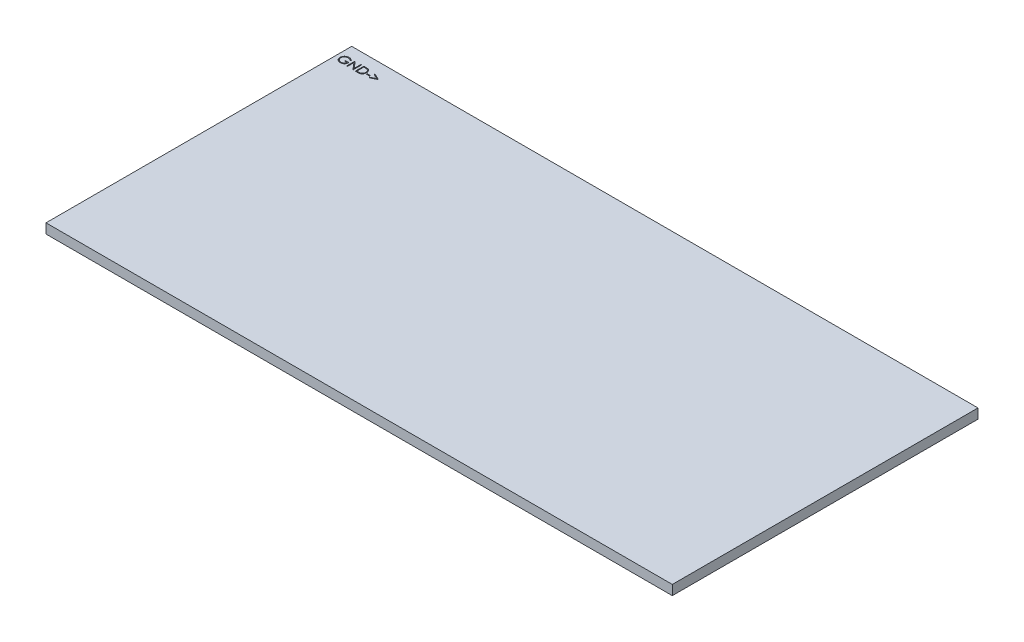
from build123d import *

# Parameters (mm, degrees)
SKETCH1_W           = 102
SKETCH1_H           = 49.784
BOSS_EXTRUDE1_DEPTH = 1.5875
SKETCH2_W           = 0.538461539
SKETCH2_H           = 0.143589744
CUT_EXTRUDE1_DEPTH  = 0.2
SKETCH5_W           = 0.538461539
SKETCH5_H           = 0.143589743
CUT_EXTRUDE2_DEPTH  = 0.2


with BuildPart() as part:
    # Sketch1 → Boss-Extrude1 (new body)
    with BuildSketch(Plane(origin=(0, 0, 0), x_dir=(1, 0, 0), z_dir=(0, 1, 0))):
        with Locations((51, 24.892)):
            Rectangle(SKETCH1_W, SKETCH1_H)
    extrude(amount=BOSS_EXTRUDE1_DEPTH)

    # Sketch2 → Cut-Extrude1 (cut)
    # profile 1 of 5: a face of its own
    with BuildSketch(Plane(origin=(0, 1.5875, 0), x_dir=(1, 0, 0), z_dir=(0, 1, 0))):
        with BuildLine():
            Line((1.979573781, 47.737471022), (1.871881473, 47.635387688))
            add(Edge.make_bspline(
                [(1.871881473, 47.635387688), (1.852393918, 47.653720034), (1.813883499, 47.689947579), (1.751099402, 47.736951977), (1.685593949, 47.777218417), (1.61770895, 47.809980911), (1.549125528, 47.836122016), (1.480754018, 47.854733272), (1.413295737, 47.866602287), (1.36842885, 47.868021634), (1.346320576, 47.868721022)],
                knots=[0, 0, 0, 0, 1.08915593, 2.152340314, 3.188132944, 4.216796309, 5.218260357, 6.173443236, 7.099959455, 8, 8, 8, 8], degree=3))
            add(Edge.make_bspline(
                [(1.346320576, 47.868721022), (1.332754696, 47.868555579), (1.30565812, 47.868225124), (1.265409342, 47.864007438), (1.225582687, 47.857941492), (1.186253337, 47.849164741), (1.147344823, 47.838041117), (1.108992466, 47.824126932), (1.071124724, 47.807904834), (1.034098292, 47.789159845), (0.99820209, 47.768567906), (0.964299356, 47.74574849), (0.932173996, 47.721432974), (0.902429826, 47.695012582), (0.874895752, 47.666726636), (0.848916403, 47.637101313), (0.825405484, 47.605327226), (0.804169018, 47.571988976), (0.785224371, 47.5376721), (0.76850091, 47.502706904), (0.754462074, 47.467209362), (0.743354292, 47.431134931), (0.734190031, 47.394762695), (0.727742988, 47.357840807), (0.724108299, 47.320329733), (0.723479587, 47.29521083), (0.723163525, 47.282583201)],
                knots=[0, 0, 0, 0, 1.02818874, 2.053710826, 3.065248034, 4.081641283, 5.106893873, 6.131558223, 7.173050175, 8.228653731, 9.27666206, 10.308777013, 11.325269123, 12.329503258, 13.32196095, 14.316845687, 15.314881793, 16.315733098, 17.311955233, 18.285320748, 19.252783886, 20.203351036, 21.145449891, 22.095197417, 23.042428769, 24, 24, 24, 24], degree=3))
            add(Edge.make_bspline(
                [(0.723163525, 47.282583201), (0.723465812, 47.269674874), (0.724069561, 47.243893469), (0.727933689, 47.20541584), (0.735104985, 47.167509679), (0.744692069, 47.130050426), (0.756684395, 47.092973926), (0.771633461, 47.056440922), (0.789339702, 47.020452766), (0.809834322, 46.985333719), (0.832308804, 46.95112451), (0.857486036, 46.918900701), (0.88423027, 46.88823319), (0.913515829, 46.859802885), (0.944403646, 46.832849326), (0.977816557, 46.808115117), (1.013097541, 46.785123828), (1.050300426, 46.76416522), (1.089021539, 46.745441806), (1.12872424, 46.728792248), (1.169535366, 46.715080513), (1.211240442, 46.703905271), (1.253789751, 46.694745152), (1.297399272, 46.68885216), (1.341748355, 46.684575828), (1.371643808, 46.68426316), (1.386705191, 46.684105637)],
                knots=[0, 0, 0, 0, 0.93586088, 1.869166235, 2.799637598, 3.729985548, 4.670839027, 5.622275134, 6.589130586, 7.576015415, 8.568469353, 9.55398029, 10.53834874, 11.515998671, 12.510579167, 13.508179873, 14.527009472, 15.561807829, 16.601455013, 17.643573243, 18.680854198, 19.719860599, 20.772568776, 21.833555941, 22.908541556, 24, 24, 24, 24], degree=3))
            add(Edge.make_bspline(
                [(1.386705191, 46.684105637), (1.40485653, 46.684485068), (1.440499633, 46.685230141), (1.49289421, 46.691030257), (1.543215438, 46.700088974), (1.59132192, 46.713355333), (1.637269528, 46.730276803), (1.681226705, 46.750674958), (1.722847368, 46.775332181), (1.762256637, 46.803161728), (1.798559512, 46.834167661), (1.831301161, 46.867625443), (1.859959357, 46.90337267), (1.884961237, 46.941198796), (1.905644698, 46.981416918), (1.922621816, 47.023829943), (1.935635133, 47.068456948), (1.940977123, 47.0992936), (1.943676345, 47.114874868)],
                knots=[0, 0, 0, 0, 1.13008108, 2.219097802, 3.278683437, 4.311054135, 5.322181354, 6.324827112, 7.324222904, 8.330512327, 9.32562643, 10.293043162, 11.24128371, 12.174520618, 13.111833804, 14.052305215, 15.015860969, 16, 16, 16, 16], degree=3))
            Line((1.943676345, 47.114874868), (1.477009678, 47.114874868))
            Line((1.477009678, 47.114874868), (1.477009678, 47.258464611))
            Line((1.477009678, 47.258464611), (2.069317371, 47.258464611))
            add(Edge.make_bspline(
                [(2.069317371, 47.258464611), (2.068635031, 47.231701616), (2.06729957, 47.179321599), (2.057932004, 47.102933491), (2.042805399, 47.030784814), (2.022141274, 46.962799585), (1.995391162, 46.899074148), (1.962842151, 46.839543801), (1.923973302, 46.784593129), (1.880169126, 46.733773527), (1.831009142, 46.688441843), (1.777821694, 46.648599467), (1.720518907, 46.615038421), (1.659154984, 46.587734156), (1.593930811, 46.566424558), (1.524695459, 46.551315928), (1.451542819, 46.542263942), (1.401408148, 46.541107391), (1.375767691, 46.540515893)],
                knots=[0, 0, 0, 0, 1.140356446, 2.231883559, 3.274166699, 4.278491846, 5.25512956, 6.21435461, 7.1637429, 8.11826594, 9.068280886, 10.0076534, 10.945064095, 11.891975133, 12.864533718, 13.863980011, 14.907571808, 16, 16, 16, 16], degree=3))
            add(Edge.make_bspline(
                [(1.375767691, 46.540515893), (1.359963637, 46.540743542), (1.328792949, 46.541192538), (1.282756578, 46.544383477), (1.237989529, 46.549295708), (1.194498326, 46.556713757), (1.152122989, 46.565799619), (1.111075155, 46.577434306), (1.071198458, 46.590901786), (1.032431264, 46.606220055), (0.995125445, 46.623968718), (0.959114838, 46.643692574), (0.924200388, 46.665289918), (0.890619922, 46.689134256), (0.858198473, 46.71504724), (0.827145096, 46.743080808), (0.797285945, 46.773149256), (0.778581759, 46.79450086), (0.769157114, 46.805259483)],
                knots=[0, 0, 0, 0, 1.107784379, 2.184907829, 3.233506516, 4.263428166, 5.276301166, 6.270063455, 7.25232949, 8.225834625, 9.190232166, 10.146266622, 11.1027726, 12.066435141, 13.031522626, 14.010570082, 14.99756817, 16, 16, 16, 16], degree=3))
            add(Edge.make_bspline(
                [(0.769157114, 46.805259483), (0.755482742, 46.822327744), (0.728360977, 46.856180951), (0.693449714, 46.910420929), (0.663689153, 46.966581673), (0.639542024, 47.024819524), (0.620686789, 47.08508001), (0.607164288, 47.147286126), (0.599241373, 47.211517978), (0.598099958, 47.254984084), (0.597522499, 47.276974227)],
                knots=[0, 0, 0, 0, 1.023165419, 2.029347347, 3.013907458, 3.994755782, 4.975994455, 5.96558838, 6.970761222, 8, 8, 8, 8], degree=3))
            add(Edge.make_bspline(
                [(0.597522499, 47.276974227), (0.597735394, 47.293440728), (0.598158479, 47.326164451), (0.603288685, 47.374747374), (0.610649253, 47.422467651), (0.621468074, 47.469286273), (0.63510658, 47.51523451), (0.652127975, 47.560333695), (0.671945933, 47.604610444), (0.694980132, 47.647759991), (0.720613915, 47.689209756), (0.748434004, 47.728792878), (0.778835444, 47.765788504), (0.811321763, 47.800665163), (0.84628056, 47.832984702), (0.883384329, 47.863046346), (0.922661666, 47.89089042), (0.964236138, 47.916078354), (1.007487212, 47.938703803), (1.052311212, 47.958539487), (1.098694457, 47.974932813), (1.146289448, 47.988842325), (1.195456448, 47.999128381), (1.245838663, 48.00658788), (1.297698708, 48.01169212), (1.332753119, 48.012102622), (1.350527307, 48.012310765)],
                knots=[0, 0, 0, 0, 1.008945113, 2.00506715, 2.99143336, 3.967273523, 4.948097931, 5.927297278, 6.919902385, 7.919676788, 8.923139349, 9.905703106, 10.883022732, 11.856032218, 12.825136022, 13.798837087, 14.781400844, 15.773989409, 16.776158564, 17.77167057, 18.775803737, 19.789618931, 20.80898985, 21.851988756, 22.910860228, 24, 24, 24, 24], degree=3))
            add(Edge.make_bspline(
                [(1.350527307, 48.012310765), (1.365022604, 48.012078969), (1.393765076, 48.011619343), (1.436535369, 48.008433484), (1.478644574, 48.003383931), (1.52015513, 47.996493217), (1.560925677, 47.98710774), (1.601072359, 47.975876427), (1.640653374, 47.962799698), (1.679544673, 47.947204159), (1.71800776, 47.929502709), (1.756256496, 47.90957734), (1.794160194, 47.887087338), (1.831784587, 47.861965924), (1.86936693, 47.834644557), (1.906312787, 47.804341827), (1.943513965, 47.772252725), (1.96743469, 47.749179852), (1.979573781, 47.737471022)],
                knots=[0, 0, 0, 0, 0.985871117, 1.954866573, 2.915460327, 3.869826059, 4.81536089, 5.759505086, 6.70452669, 7.649098992, 8.607881297, 9.583363685, 10.581137262, 11.603961102, 12.659522466, 13.73993555, 14.853081303, 16, 16, 16, 16], degree=3))
        make_face()
    # profile 2 of 5: a face of its own
    with BuildSketch(Plane(origin=(0, 1.5875, 0), x_dir=(1, 0, 0), z_dir=(0, 1, 0))):
        Polygon((2.356496858, 46.576413329), (2.356496858, 47.976413329), (2.382859037, 47.976413329), (3.307778909, 46.874530317), (3.307778909, 47.976413329), (3.433419935, 47.976413329), (3.433419935, 46.576413329), (3.404814166, 46.576413329), (2.482137884, 47.675772304), (2.482137884, 46.576413329), align=None)
    # profile 3 of 5: a face of its own
    with BuildSketch(Plane(origin=(0, 1.5875, 0), x_dir=(1, 0, 0), z_dir=(0, 1, 0))):
        with BuildLine():
            Line((3.792394294, 46.576413329), (3.792394294, 47.976413329))
            Line((3.792394294, 47.976413329), (4.075086602, 47.976413329))
            add(Edge.make_bspline(
                [(4.075086602, 47.976413329), (4.099674197, 47.976236301), (4.147177303, 47.975894284), (4.215822282, 47.973725728), (4.279335787, 47.969889541), (4.337508931, 47.964301731), (4.390501415, 47.957440517), (4.438164859, 47.948840356), (4.480745716, 47.938685088), (4.506933492, 47.930026907), (4.519317371, 47.92593256)],
                knots=[0, 0, 0, 0, 1.314313732, 2.53924729, 3.670748893, 4.714932338, 5.66265055, 6.526160246, 7.303039223, 8, 8, 8, 8], degree=3))
            add(Edge.make_bspline(
                [(4.519317371, 47.92593256), (4.535515266, 47.919760278), (4.567543743, 47.90755568), (4.613146592, 47.88453316), (4.656076738, 47.858447919), (4.696564396, 47.829265574), (4.733684726, 47.796159835), (4.768887885, 47.760537), (4.800733774, 47.721101664), (4.829897093, 47.678671669), (4.856191357, 47.633746848), (4.87904702, 47.586412805), (4.898028617, 47.536909921), (4.913785908, 47.485375862), (4.926204491, 47.431697311), (4.934677263, 47.375811765), (4.940265659, 47.317940089), (4.94082728, 47.278670303), (4.941112243, 47.25874506)],
                knots=[0, 0, 0, 0, 0.984719456, 1.947108742, 2.898477687, 3.838006223, 4.779231079, 5.722358779, 6.681677486, 7.655904652, 8.64651281, 9.637519902, 10.640069247, 11.656948941, 12.698408672, 13.768548281, 14.867775369, 16, 16, 16, 16], degree=3))
            add(Edge.make_bspline(
                [(4.941112243, 47.25874506), (4.940860656, 47.241440565), (4.940364877, 47.207340249), (4.935913151, 47.157083891), (4.929442623, 47.108318462), (4.919424944, 47.061276182), (4.907263938, 47.015544895), (4.891678278, 46.971611997), (4.873824079, 46.929074474), (4.853004128, 46.888507483), (4.830147574, 46.850074134), (4.805618877, 46.813843923), (4.779444198, 46.780333834), (4.751373945, 46.74944239), (4.721770859, 46.721216158), (4.690441126, 46.695419352), (4.657303906, 46.67255673), (4.622507617, 46.651729887), (4.585037165, 46.633561745), (4.544182819, 46.618189741), (4.499770348, 46.605451095), (4.451908765, 46.594822736), (4.400515374, 46.586391815), (4.345539787, 46.580741258), (4.287066472, 46.576920085), (4.246914765, 46.576585528), (4.226248461, 46.576413329)],
                knots=[0, 0, 0, 0, 1.105936401, 2.179363191, 3.223086493, 4.248585256, 5.251745608, 6.245858792, 7.225916811, 8.198733463, 9.158002045, 10.082870192, 10.993790845, 11.873723703, 12.748670949, 13.606408763, 14.465103618, 15.319838547, 16.196477973, 17.123216899, 18.106603292, 19.147568657, 20.255746949, 21.433717677, 22.679120308, 24, 24, 24, 24], degree=3))
            Line((4.226248461, 46.576413329), (3.792394294, 46.576413329))
        make_face()
        with BuildLine():
            Line((3.918035319, 46.720003073), (4.078732435, 46.720003073))
            add(Edge.make_bspline(
                [(4.078732435, 46.720003073), (4.101823783, 46.720102311), (4.146236903, 46.720293184), (4.210100101, 46.721968065), (4.26845186, 46.72470484), (4.321300464, 46.728534871), (4.368616074, 46.733602317), (4.410497573, 46.739252278), (4.446807677, 46.746291258), (4.468779452, 46.752671642), (4.478932755, 46.75562006)],
                knots=[0, 0, 0, 0, 1.375205317, 2.645023457, 3.804390687, 4.853969522, 5.800190428, 6.637939096, 7.370582563, 8, 8, 8, 8], degree=3))
            add(Edge.make_bspline(
                [(4.478932755, 46.75562006), (4.4917121, 46.760120683), (4.516965555, 46.769014433), (4.55331799, 46.785237497), (4.587220791, 46.804454325), (4.619264802, 46.825815235), (4.648995464, 46.850073635), (4.67676511, 46.876702031), (4.702517831, 46.905835941), (4.725987554, 46.937439206), (4.746990876, 46.971315124), (4.765179367, 47.007130657), (4.78111998, 47.044493381), (4.793631417, 47.083977045), (4.803437651, 47.125228668), (4.810383526, 47.168251154), (4.814709416, 47.213036466), (4.815213995, 47.243497316), (4.815471217, 47.259025509)],
                knots=[0, 0, 0, 0, 0.998632004, 1.973411704, 2.929992603, 3.868527914, 4.809262121, 5.754881198, 6.702106254, 7.672490631, 8.653608572, 9.636854334, 10.631411391, 11.644891563, 12.686317036, 13.754757253, 14.855430412, 16, 16, 16, 16], degree=3))
            add(Edge.make_bspline(
                [(4.815471217, 47.259025509), (4.815265902, 47.275398901), (4.814862559, 47.307564575), (4.809792835, 47.354760853), (4.802384213, 47.400153113), (4.791670738, 47.443744391), (4.778018387, 47.485619732), (4.76098053, 47.525547536), (4.741513882, 47.563949484), (4.718352547, 47.59993923), (4.69298631, 47.633976474), (4.664835158, 47.66515844), (4.634346343, 47.69355616), (4.601852403, 47.719611885), (4.566437563, 47.742277355), (4.528936087, 47.762552028), (4.488797819, 47.779758384), (4.46087274, 47.788909929), (4.446681153, 47.793560765)],
                knots=[0, 0, 0, 0, 1.122418816, 2.205001699, 3.251619955, 4.274784885, 5.280384055, 6.268708349, 7.249350384, 8.229342522, 9.199999885, 10.157847722, 11.105861043, 12.055065948, 13.010012805, 13.98527497, 14.976112212, 16, 16, 16, 16], degree=3))
            add(Edge.make_bspline(
                [(4.446681153, 47.793560765), (4.434940694, 47.796807336), (4.409977258, 47.803710437), (4.369241473, 47.811240586), (4.323395413, 47.817882386), (4.272235532, 47.823505602), (4.215820149, 47.82754053), (4.154105873, 47.830569056), (4.087066032, 47.832611709), (4.040593018, 47.832751192), (4.016472819, 47.832823586)],
                knots=[0, 0, 0, 0, 0.674548936, 1.434276114, 2.292660221, 3.240891867, 4.284742987, 5.42552168, 6.663806718, 8, 8, 8, 8], degree=3))
            Line((4.016472819, 47.832823586), (3.918035319, 47.832823586))
            Line((3.918035319, 47.832823586), (3.918035319, 46.720003073))
        make_face(mode=Mode.SUBTRACT)
    # profile 4 of 5: a face of its own
    with BuildSketch(Plane(origin=(0, 1.5875, 0), x_dir=(1, 0, 0), z_dir=(0, 1, 0))):
        with Locations((5.371881474, 47.114874868)):
            Rectangle(SKETCH2_W, SKETCH2_H)
    # profile 5 of 5: a face of its own
    with BuildSketch(Plane(origin=(0, 1.5875, 0), x_dir=(1, 0, 0), z_dir=(0, 1, 0))):
        Polygon((5.802650704, 46.892479034), (6.588468012, 47.26743897), (5.802650704, 47.642398906), (5.802650704, 47.778977432), (6.771881473, 47.316517496), (6.771881473, 47.218360445), (5.802650704, 46.755900509), align=None)
    extrude(amount=-CUT_EXTRUDE1_DEPTH, mode=Mode.SUBTRACT)

    # Sketch5 → Cut-Extrude2 (cut)
    # profile 1 of 5: a face of its own
    with BuildSketch(Plane.XZ):
        with BuildLine():
            Line((99.651881869, -8.835487078), (99.759574177, -8.733403745))
            add(Edge.make_bspline(
                [(99.759574177, -8.733403745), (99.779175842, -8.751710916), (99.8178077, -8.787791526), (99.880489648, -8.835127659), (99.945978993, -8.875362021), (100.013743302, -8.908417616), (100.082475826, -8.934112893), (100.150804316, -8.952691933), (100.218249726, -8.964640525), (100.263025991, -8.966044058), (100.285135074, -8.966737078)],
                knots=[0, 0, 0, 0, 1.091957225, 2.152079168, 3.193085318, 4.218301889, 5.218403563, 6.17723952, 7.099979378, 8, 8, 8, 8], degree=3))
            add(Edge.make_bspline(
                [(100.285135074, -8.966737078), (100.298700878, -8.966571391), (100.325797302, -8.966240448), (100.366047213, -8.962026398), (100.405869614, -8.955946802), (100.445127178, -8.947240762), (100.483975989, -8.935933089), (100.522329623, -8.92228076), (100.560114058, -8.905846268), (100.597130519, -8.887109443), (100.633199685, -8.866655116), (100.667122928, -8.843842484), (100.699041711, -8.81937356), (100.72873032, -8.79292744), (100.756595423, -8.764944288), (100.782126935, -8.735026497), (100.805883193, -8.703616878), (100.826975631, -8.670265196), (100.846040083, -8.635919084), (100.862548275, -8.600852326), (100.876762784, -8.565312239), (100.888121044, -8.529278791), (100.897252651, -8.492774989), (100.903716121, -8.455857867), (100.907346476, -8.418345536), (100.90797577, -8.393226801), (100.908292125, -8.380599258)],
                knots=[0, 0, 0, 0, 1.028307134, 2.053947307, 3.065600992, 4.082111276, 5.100671203, 6.132125737, 7.167228006, 8.222953114, 9.277225349, 10.309459149, 11.320441984, 12.324791754, 13.322338422, 14.312705492, 15.305176196, 16.306142747, 17.302479595, 18.282363326, 19.243345101, 20.20291386, 21.145121196, 22.094978082, 23.042318507, 24, 24, 24, 24], degree=3))
            add(Edge.make_bspline(
                [(100.908292125, -8.380599258), (100.907986948, -8.367691717), (100.907377426, -8.341911882), (100.90355646, -8.303422511), (100.896226075, -8.265583241), (100.887272098, -8.228037099), (100.874597988, -8.191263311), (100.859864729, -8.154723339), (100.842099723, -8.118756777), (100.821642921, -8.083614328), (100.79903596, -8.049415274), (100.774176335, -8.016930015), (100.747017095, -7.986538199), (100.718057578, -7.957795483), (100.687033563, -7.930883377), (100.653644155, -7.906126234), (100.618356717, -7.883141243), (100.581155602, -7.862180909), (100.54243401, -7.843457962), (100.502731437, -7.826808278), (100.461920277, -7.813096576), (100.42021521, -7.801921326), (100.377665899, -7.792761209), (100.334056378, -7.786868217), (100.289707295, -7.782591884), (100.259811842, -7.782279216), (100.244750459, -7.782121694)],
                knots=[0, 0, 0, 0, 0.935896426, 1.86923723, 2.799743935, 3.728471844, 4.66505513, 5.616527375, 6.583419551, 7.570341864, 8.562833498, 9.553750335, 10.533080376, 11.5155245, 12.510142773, 13.507781369, 14.526649666, 15.561487327, 16.601173999, 17.643331812, 18.680652164, 19.71969803, 20.772446191, 21.833473655, 22.9085001, 24, 24, 24, 24], degree=3))
            add(Edge.make_bspline(
                [(100.244750459, -7.782121694), (100.226599046, -7.782500967), (100.190955798, -7.783245731), (100.138562271, -7.78904808), (100.088237219, -7.798098666), (100.040144498, -7.811394295), (99.99410949, -7.828223243), (99.950302281, -7.849034791), (99.908600792, -7.873609274), (99.869189672, -7.901451642), (99.832990611, -7.932465136), (99.800087708, -7.96566017), (99.77144513, -8.00130161), (99.746876082, -8.039381697), (99.725729206, -8.079339717), (99.708860621, -8.121860543), (99.695813584, -8.16646924), (99.6904762, -8.197308393), (99.687779305, -8.212890924)],
                knots=[0, 0, 0, 0, 1.130234505, 2.219399076, 3.279128566, 4.311639422, 5.322903917, 6.328167287, 7.327698761, 8.334124803, 9.329374007, 10.292761544, 11.24113083, 12.171311216, 13.111441694, 14.052040787, 15.015727358, 16, 16, 16, 16], degree=3))
            Line((99.687779305, -8.212890924), (100.154445972, -8.212890924))
            Line((100.154445972, -8.212890924), (100.154445972, -8.356480668))
            Line((100.154445972, -8.356480668), (99.562138279, -8.356480668))
            add(Edge.make_bspline(
                [(99.562138279, -8.356480668), (99.562820619, -8.329717672), (99.56415608, -8.277337656), (99.573523646, -8.200949547), (99.588650251, -8.12880087), (99.609314376, -8.060815641), (99.636064488, -7.997090204), (99.668613499, -7.937559858), (99.707482348, -7.882609185), (99.751286524, -7.831789584), (99.800446508, -7.786457899), (99.853633956, -7.746615524), (99.910936743, -7.713054478), (99.972300666, -7.685750213), (100.037524839, -7.664440615), (100.106760191, -7.649331984), (100.179912831, -7.640279999), (100.230047502, -7.639123447), (100.255687959, -7.63853195)],
                knots=[0, 0, 0, 0, 1.140356446, 2.231883559, 3.274166699, 4.278491846, 5.25512956, 6.21435461, 7.1637429, 8.11826594, 9.068280886, 10.0076534, 10.945064095, 11.891975133, 12.864533718, 13.863980011, 14.907571808, 16, 16, 16, 16], degree=3))
            add(Edge.make_bspline(
                [(100.255687959, -7.63853195), (100.271492013, -7.638759598), (100.302662701, -7.639208595), (100.348699072, -7.642399534), (100.393466121, -7.647311764), (100.436957324, -7.654729814), (100.479332661, -7.663815675), (100.520380495, -7.675450363), (100.560257192, -7.688917842), (100.599024386, -7.704236112), (100.636330205, -7.721984774), (100.672340812, -7.74170863), (100.707255262, -7.763305975), (100.740835728, -7.787150313), (100.773257177, -7.813063297), (100.804310554, -7.841096865), (100.834169705, -7.871165312), (100.852873891, -7.892516916), (100.862298536, -7.90327554)],
                knots=[0, 0, 0, 0, 1.107784379, 2.184907829, 3.233506516, 4.263428166, 5.276301166, 6.270063455, 7.25232949, 8.225834625, 9.190232166, 10.146266622, 11.1027726, 12.066435141, 13.031522626, 14.010570082, 14.99756817, 16, 16, 16, 16], degree=3))
            add(Edge.make_bspline(
                [(100.862298536, -7.90327554), (100.875972908, -7.920343801), (100.903094674, -7.954197008), (100.938005936, -8.008436986), (100.967766497, -8.06459773), (100.991913626, -8.122835581), (101.010768861, -8.183096066), (101.024291362, -8.245302183), (101.032214277, -8.309534035), (101.033355692, -8.353000141), (101.033933151, -8.374990283)],
                knots=[0, 0, 0, 0, 1.023165419, 2.029347347, 3.013907458, 3.994755782, 4.975994455, 5.96558838, 6.970761222, 8, 8, 8, 8], degree=3))
            add(Edge.make_bspline(
                [(101.033933151, -8.374990283), (101.033719679, -8.391456611), (101.033295448, -8.42417999), (101.028173727, -8.47276546), (101.020781417, -8.52047621), (101.01007394, -8.567356417), (100.995985583, -8.613197952), (100.979066009, -8.658353059), (100.959248376, -8.702641257), (100.936121924, -8.745670006), (100.910949049, -8.787424593), (100.882642549, -8.826590782), (100.852774898, -8.863925885), (100.819915174, -8.898372873), (100.785294704, -8.931032189), (100.748052355, -8.961043033), (100.708799142, -8.988911744), (100.667218109, -9.014092978), (100.623968813, -9.036720242), (100.579144337, -9.056555441), (100.532761221, -9.072948898), (100.485166195, -9.086858374), (100.435999204, -9.09714444), (100.385616987, -9.104603936), (100.333756942, -9.109708176), (100.298702531, -9.110118678), (100.280928343, -9.110326822)],
                knots=[0, 0, 0, 0, 1.009025537, 2.005226976, 2.991671811, 3.967589759, 4.950148279, 5.929425679, 6.922109907, 7.921964004, 8.922507644, 9.908469609, 10.882248289, 11.851158214, 12.824245259, 13.798023939, 14.780666017, 15.773333703, 16.775582742, 17.771174102, 18.775387309, 19.789283316, 20.80873549, 21.851817535, 22.910773411, 24, 24, 24, 24], degree=3))
            add(Edge.make_bspline(
                [(100.280928343, -9.110326822), (100.26643294, -9.110095604), (100.237690258, -9.109637127), (100.194921517, -9.10644279), (100.152898044, -9.101435908), (100.111409034, -9.094434621), (100.070612458, -9.085173054), (100.030384717, -9.073885883), (99.990801895, -9.060817521), (99.951911081, -9.045219734), (99.913447862, -9.027518898), (99.875199162, -9.00759336), (99.837295454, -8.985103405), (99.799671064, -8.959981978), (99.76208872, -8.932660614), (99.725142863, -8.902357884), (99.687941685, -8.870268782), (99.66402096, -8.847195908), (99.651881869, -8.835487078)],
                knots=[0, 0, 0, 0, 0.985875312, 1.954874891, 2.915472732, 3.863573565, 4.815313299, 5.759461513, 6.704487138, 7.649063459, 8.607849844, 9.583336382, 10.581114205, 11.603942397, 12.659508253, 13.739925933, 14.853076422, 16, 16, 16, 16], degree=3))
        make_face()
    # profile 2 of 5: a face of its own
    with BuildSketch(Plane.XZ):
        Polygon((99.274958792, -7.674429386), (99.274958792, -9.074429386), (99.248596613, -9.074429386), (98.323676741, -7.972546373), (98.323676741, -9.074429386), (98.198035715, -9.074429386), (98.198035715, -7.674429386), (98.226641484, -7.674429386), (99.149317766, -8.77378836), (99.149317766, -7.674429386), align=None)
    # profile 3 of 5: a face of its own
    with BuildSketch(Plane.XZ):
        with BuildLine():
            Line((97.839061356, -7.674429386), (97.839061356, -9.074429386))
            Line((97.839061356, -9.074429386), (97.556369049, -9.074429386))
            add(Edge.make_bspline(
                [(97.556369049, -9.074429386), (97.531781402, -9.07425284), (97.484278197, -9.073911755), (97.415633903, -9.071736737), (97.352210986, -9.067927977), (97.294045464, -9.062273052), (97.24104389, -9.055485557), (97.19329115, -9.046853559), (97.150709859, -9.036701744), (97.124522134, -9.028043157), (97.112138279, -9.023948617)],
                knots=[0, 0, 0, 0, 1.314317071, 2.539253741, 3.67075822, 4.709970291, 5.662644612, 6.526156501, 7.303037452, 8, 8, 8, 8], degree=3))
            add(Edge.make_bspline(
                [(97.112138279, -9.023948617), (97.095938935, -9.01777825), (97.063907594, -9.005577439), (97.018325773, -8.982527115), (96.975270052, -8.95651688), (96.935080401, -8.92695041), (96.897668262, -8.894205528), (96.862562912, -8.858547168), (96.830770578, -8.819023372), (96.801194735, -8.776860547), (96.775308199, -8.731675004), (96.752481249, -8.684371804), (96.732990499, -8.635042727), (96.717782479, -8.583327844), (96.705218026, -8.529723854), (96.696787586, -8.47382491), (96.691187584, -8.415956907), (96.69062756, -8.376686616), (96.690343407, -8.356761117)],
                knots=[0, 0, 0, 0, 0.984696416, 1.947063185, 2.89840987, 3.841051395, 4.778753227, 5.721858861, 6.681155121, 7.65838316, 8.646299769, 9.637283673, 10.641736726, 11.657050558, 12.698485921, 13.768600492, 14.86780186, 16, 16, 16, 16], degree=3))
            add(Edge.make_bspline(
                [(96.690343407, -8.356761117), (96.690595164, -8.33945668), (96.691091277, -8.30535648), (96.695540574, -8.255099282), (96.70201998, -8.206336922), (96.712005463, -8.159283512), (96.724275393, -8.113622254), (96.739419615, -8.069569347), (96.757369363, -8.02709485), (96.778185973, -7.986536127), (96.800979311, -7.947991801), (96.825816395, -7.912072583), (96.851846819, -7.878382447), (96.880019959, -7.847682491), (96.909403032, -7.81901671), (96.940995396, -7.793656719), (96.973807857, -7.770425187), (97.008826197, -7.750027616), (97.046337728, -7.73188337), (97.087322305, -7.716560446), (97.131630345, -7.703373928), (97.179555443, -7.692867812), (97.230937763, -7.684399351), (97.285916592, -7.67875979), (97.344388979, -7.674935464), (97.384540817, -7.674601354), (97.40520719, -7.674429386)],
                knots=[0, 0, 0, 0, 1.105894396, 2.179280415, 3.222964075, 4.248423888, 5.251546139, 6.243661943, 7.223682738, 8.196462441, 9.155694589, 10.083899862, 10.986397372, 11.874737962, 12.745335529, 13.607670254, 14.461432187, 15.313100333, 16.195087267, 17.121790994, 18.106827133, 19.14775296, 20.255889161, 21.433815148, 22.679170477, 24, 24, 24, 24], degree=3))
            Line((97.40520719, -7.674429386), (97.839061356, -7.674429386))
        make_face()
        with BuildLine():
            Line((97.713420331, -7.818019129), (97.552723215, -7.818019129))
            add(Edge.make_bspline(
                [(97.552723215, -7.818019129), (97.529631867, -7.818118368), (97.485218748, -7.81830924), (97.421355549, -7.819984121), (97.36300379, -7.822720896), (97.310155186, -7.826550927), (97.262839577, -7.831618374), (97.220958077, -7.837268335), (97.184647973, -7.844307315), (97.162676198, -7.850687699), (97.152522895, -7.853636117)],
                knots=[0, 0, 0, 0, 1.375205317, 2.645023457, 3.804390687, 4.853969522, 5.800190428, 6.637939096, 7.370582563, 8, 8, 8, 8], degree=3))
            add(Edge.make_bspline(
                [(97.152522895, -7.853636117), (97.139743278, -7.858136404), (97.114489286, -7.867029488), (97.078140779, -7.883257415), (97.04422349, -7.902456304), (97.012171983, -7.923923343), (96.982192242, -7.947990006), (96.954423101, -7.974732828), (96.928645218, -8.003842203), (96.905271322, -8.035416216), (96.884131488, -8.069104538), (96.86586674, -8.104869642), (96.850469765, -8.142510828), (96.83783757, -8.181897134), (96.82798879, -8.223052004), (96.821054861, -8.266078715), (96.816757987, -8.310960274), (96.816245096, -8.341513656), (96.815984433, -8.357041565)],
                knots=[0, 0, 0, 0, 0.998420628, 1.972994, 2.929372424, 3.86770908, 4.81360496, 5.759023883, 6.706048443, 7.676227424, 8.651287839, 9.634325482, 10.632389399, 11.645655052, 12.680158286, 13.74837235, 14.855672678, 16, 16, 16, 16], degree=3))
            add(Edge.make_bspline(
                [(96.815984433, -8.357041565), (96.816189967, -8.373414859), (96.81659374, -8.405580341), (96.821660362, -8.452778008), (96.829080224, -8.498165233), (96.839753118, -8.541774691), (96.853541577, -8.583549646), (96.870040585, -8.623726107), (96.890072971, -8.661787044), (96.912751749, -8.698054816), (96.938212831, -8.731980172), (96.966343273, -8.763165658), (96.996846456, -8.791669364), (97.0295818, -8.817536675), (97.065007001, -8.840307574), (97.102522595, -8.860564211), (97.142657039, -8.877775454), (97.170582643, -8.886926327), (97.184774497, -8.891576822)],
                knots=[0, 0, 0, 0, 1.122272916, 2.204715076, 3.251197285, 4.274229216, 5.279697671, 6.265416158, 7.248880903, 8.225321784, 9.195852973, 10.153576302, 11.101466393, 12.055578741, 13.010401466, 13.985536859, 14.976245305, 16, 16, 16, 16], degree=3))
            add(Edge.make_bspline(
                [(97.184774497, -8.891576822), (97.196514956, -8.894823393), (97.221478392, -8.901726494), (97.262214177, -8.909256643), (97.308060237, -8.915898443), (97.359220118, -8.921521658), (97.415635501, -8.925556587), (97.477349777, -8.928585113), (97.544389618, -8.930627766), (97.590862632, -8.930767249), (97.614982831, -8.930839642)],
                knots=[0, 0, 0, 0, 0.674548936, 1.434276114, 2.292660221, 3.240891867, 4.284742987, 5.42552168, 6.663806718, 8, 8, 8, 8], degree=3))
            Line((97.614982831, -8.930839642), (97.713420331, -8.930839642))
            Line((97.713420331, -8.930839642), (97.713420331, -7.818019129))
        make_face(mode=Mode.SUBTRACT)
    # profile 4 of 5: a face of its own
    with BuildSketch(Plane.XZ):
        with Locations((96.259574177, -8.212890924)):
            Rectangle(SKETCH5_W, SKETCH5_H)
    # profile 5 of 5: a face of its own
    with BuildSketch(Plane.XZ):
        Polygon((95.828804946, -7.990495091), (95.042987638, -8.365455027), (95.828804946, -8.740414963), (95.828804946, -8.876993488), (94.859574177, -8.414533553), (94.859574177, -8.316376501), (95.828804946, -7.853916565), align=None)
    extrude(amount=-CUT_EXTRUDE2_DEPTH, mode=Mode.SUBTRACT)


solid = part.part
